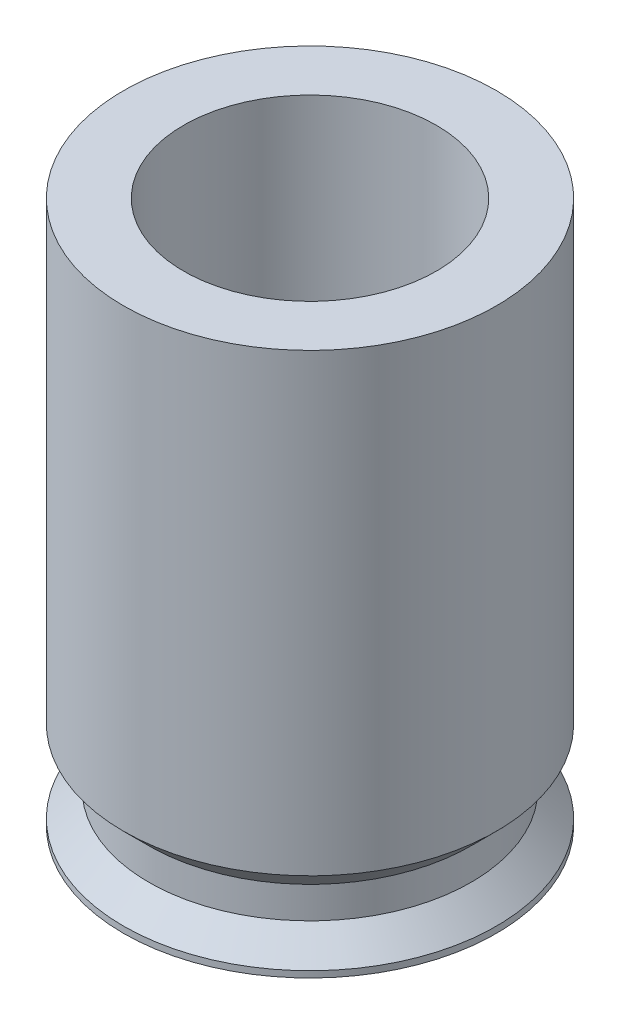
from build123d import *

# Parameters (mm, degrees)
SKETCH_1_R      = 2.95
SKETCH_1_R_2    = 2
EXTRUDE_1_DEPTH = 4.3
SKETCH_2_W      = 0.4
SKETCH_2_H      = 0.5
CHAMFER_1_SIZE  = 0.4


with BuildPart() as part:
    # 草图1 → 凸台-拉伸1 (new, symmetric)
    with BuildSketch(Plane(origin=(0, 0, 0), x_dir=(1, 0, 0), z_dir=(0, 1, 0))):
        with Locations(Location((0, 0, 0), (0, 0, 90))):
            Circle(SKETCH_1_R)
        with Locations(Location((0, 0, 0), (0, 0, 90))):
            Circle(SKETCH_1_R_2, mode=Mode.SUBTRACT)
    extrude(amount=EXTRUDE_1_DEPTH, both=True)

    # 草图2 → 切除-旋转1 (revolve, cut)
    with BuildSketch(Plane(origin=(0, 0, 0), x_dir=(0, 0, -1), z_dir=(1, 0, 0)), mode=Mode.PRIVATE) as cut_revolve_1_sk:
        with Locations((-2.75, -3.55)):
            Rectangle(SKETCH_2_W, SKETCH_2_H)
    revolve(cut_revolve_1_sk.sketch.rotate(Axis((0, -1000, 0), (0, 1, 0)), 180), axis=Axis((0, -1000, 0), (0, 1, 0)), mode=Mode.SUBTRACT)

    # 倒角1
    chamfer_1_edges = [part.edges().sort_by_distance(p)[0] for p in [
        (0, -3.3, 2.95),
        (0, -3.8, 2.95),
    ]]
    chamfer(chamfer_1_edges, length=CHAMFER_1_SIZE - 0.0001)  # a hair under: the kernel refuses the full size


solid = part.part
